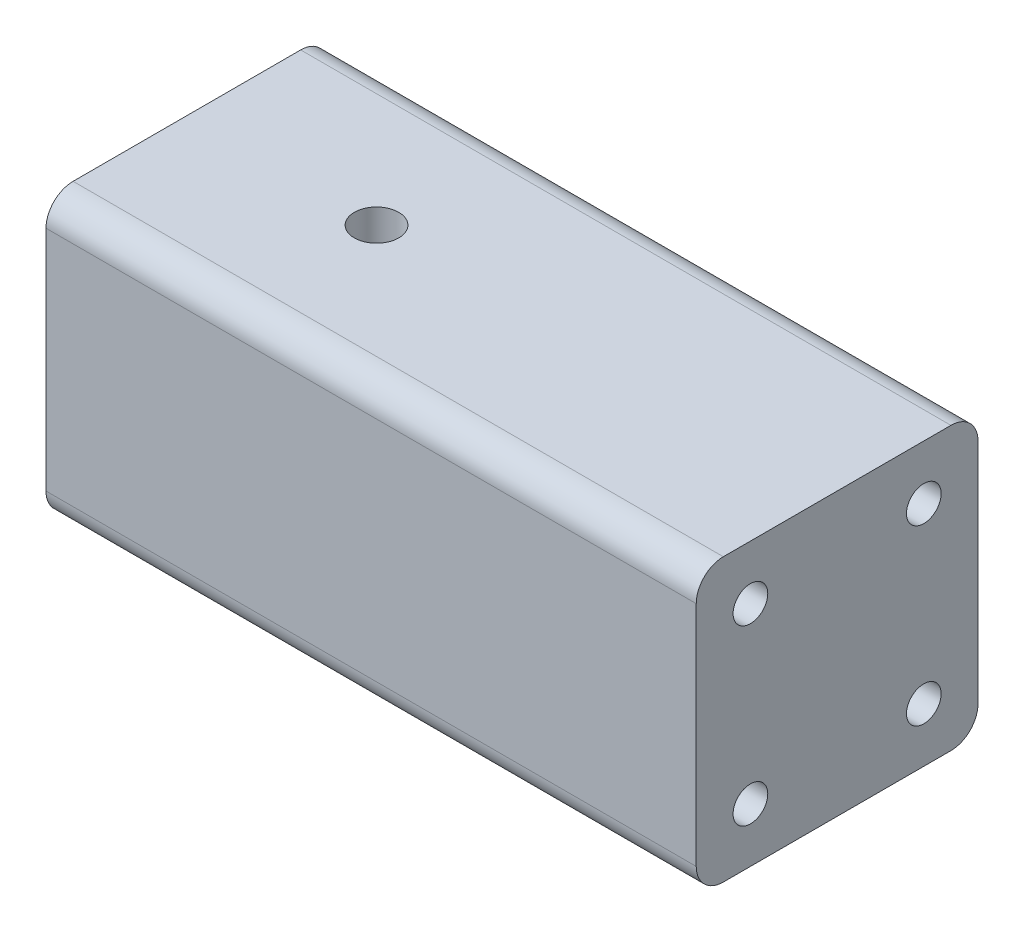
from build123d import *

# Parameters (mm, degrees)
BOSS_EXTRUDE1_DEPTH      = 39
BOSS_EXTRUDE1_DEPTH_BACK = 20
SKETCH1_W                = 42
SKETCH1_H                = 40
CUT_EXTRUDE3_DEPTH       = 68.939361812
CUT_EXTRUDE3_DEPTH_BACK  = 68.939361812
BOSS_EXTRUDE2_DEPTH      = 40
CUT_EXTRUDE7_START       = -10
SKETCH7_R                = 2.05
CUT_EXTRUDE7_DEPTH       = 116.132850877
CUT_EXTRUDE8_DEPTH       = 3.125
SKETCH9_R                = 2.778089848
BOSS_EXTRUDE3_DEPTH      = 6
CIRPATTERN1_COUNT        = 2
SKETCH10_W               = 6.985924482
SKETCH10_H               = 7.120269183
CUT_EXTRUDE13_DEPTH      = 8
SKETCH14_OUTSIDE_W       = 60.69
SKETCH14_OUTSIDE_H       = 58.69
CUT_EXTRUDE14_DEPTH      = 116.302529068
CHAMFER1_SIZE            = 5.5
SKETCH17_W               = 21.827069389
SKETCH17_H               = 22.909403407
BOSS_EXTRUDE4_DEPTH      = 15
SKETCH18_R               = 1.6
CUT_EXTRUDE15_DEPTH      = 107.928426814


with BuildPart() as part:
    # Sketch1 → Boss-Extrude1 (new, two sides: drawn at the far end of the back side and taken through both)
    with BuildSketch(Plane.ZY.offset(-BOSS_EXTRUDE1_DEPTH_BACK)):
        with Locations((70.454449321, -16.479540615)):
            Rectangle(SKETCH1_W, SKETCH1_H)
        with BuildLine():
            Line((77.147342539, -21.970352305), (75.054449321, -19.877459087))
            Line((75.054449321, -19.877459087), (75.054449321, -13.081622143))
            Line((75.054449321, -13.081622143), (77.147342539, -10.988728924))
            ThreePointArc((77.147342539, -10.988728924), (78.237132753, -10.771956173), (78.854449321, -11.695835705))
            Line((78.854449321, -11.695835705), (78.854449321, -13.429540615))
            Line((78.854449321, -13.429540615), (80.554449321, -13.429540615))
            Line((80.554449321, -13.429540615), (80.554449321, -6.979540615))
            ThreePointArc((80.554449321, -6.979540615), (80.378713389, -6.555276546), (79.954449321, -6.379540615))
            Line((79.954449321, -6.379540615), (73.504449321, -6.379540615))
            Line((73.504449321, -6.379540615), (73.504449321, -8.079540615))
            Line((73.504449321, -8.079540615), (75.23815423, -8.079540615))
            ThreePointArc((75.23815423, -8.079540615), (76.162033763, -8.696857182), (75.945261011, -9.786647396))
            Line((75.945261011, -9.786647396), (73.852367793, -11.879540615))
            Line((73.852367793, -11.879540615), (67.056530849, -11.879540615))
            Line((67.056530849, -11.879540615), (64.96363763, -9.786647396))
            ThreePointArc((64.96363763, -9.786647396), (64.746864878, -8.696857182), (65.670744411, -8.079540615))
            Line((65.670744411, -8.079540615), (67.404449321, -8.079540615))
            Line((67.404449321, -8.079540615), (67.404449321, -6.379540615))
            Line((67.404449321, -6.379540615), (60.954449321, -6.379540615))
            ThreePointArc((60.954449321, -6.379540615), (60.530185252, -6.555276546), (60.354449321, -6.979540615))
            Line((60.354449321, -6.979540615), (60.354449321, -13.429540615))
            Line((60.354449321, -13.429540615), (62.054449321, -13.429540615))
            Line((62.054449321, -13.429540615), (62.054449321, -11.695835705))
            ThreePointArc((62.054449321, -11.695835705), (62.671765888, -10.771956173), (63.761556102, -10.988728924))
            Line((63.761556102, -10.988728924), (65.854449321, -13.081622143))
            Line((65.854449321, -13.081622143), (65.854449321, -19.877459087))
            Line((65.854449321, -19.877459087), (63.761556102, -21.970352305))
            ThreePointArc((63.761556102, -21.970352305), (62.671765888, -22.187125057), (62.054449321, -21.263245524))
            Line((62.054449321, -21.263245524), (62.054449321, -19.529540615))
            Line((62.054449321, -19.529540615), (60.354449321, -19.529540615))
            Line((60.354449321, -19.529540615), (60.354449321, -25.979540615))
            ThreePointArc((60.354449321, -25.979540615), (60.530185252, -26.403804683), (60.954449321, -26.579540615))
            Line((60.954449321, -26.579540615), (67.404449321, -26.579540615))
            Line((67.404449321, -26.579540615), (67.404449321, -24.879540615))
            Line((67.404449321, -24.879540615), (65.670744411, -24.879540615))
            ThreePointArc((65.670744411, -24.879540615), (64.746864878, -24.262224047), (64.96363763, -23.172433833))
            Line((64.96363763, -23.172433833), (67.056530849, -21.079540615))
            Line((67.056530849, -21.079540615), (73.852367793, -21.079540615))
            Line((73.852367793, -21.079540615), (75.945261011, -23.172433833))
            ThreePointArc((75.945261011, -23.172433833), (76.162033763, -24.262224047), (75.23815423, -24.879540615))
            Line((75.23815423, -24.879540615), (73.504449321, -24.879540615))
            Line((73.504449321, -24.879540615), (73.504449321, -26.579540615))
            Line((73.504449321, -26.579540615), (79.954449321, -26.579540615))
            ThreePointArc((79.954449321, -26.579540615), (80.378713389, -26.403804683), (80.554449321, -25.979540615))
            Line((80.554449321, -25.979540615), (80.554449321, -19.529540615))
            Line((80.554449321, -19.529540615), (78.854449321, -19.529540615))
            Line((78.854449321, -19.529540615), (78.854449321, -21.263245524))
            ThreePointArc((78.854449321, -21.263245524), (78.237132753, -22.187125057), (77.147342539, -21.970352305))
        make_face(mode=Mode.SUBTRACT)
    extrude(amount=BOSS_EXTRUDE1_DEPTH + BOSS_EXTRUDE1_DEPTH_BACK)

    # Sketch2 → Cut-Extrude3 (cut, two sides: drawn at the far end of the back side and taken through both)
    with BuildSketch(Plane(origin=(0, 0, 91.454449321), x_dir=(-1, 0, 0), z_dir=(0, 0, -1)).offset(-CUT_EXTRUDE3_DEPTH_BACK)):
        with BuildLine():
            Line((9, 3.520459385), (39, 3.520459385))
            Line((39, 3.520459385), (39, -36.479540615))
            Line((39, -36.479540615), (30.968670474, -36.479540615))
            ThreePointArc((30.968670474, -36.479540615), (30.884335237, -36.480014542), (30.8, -36.479540615))
            Line((30.8, -36.479540615), (30.8, -37.552822487))
            Line((30.8, -37.552822487), (41.446354872, -37.552822487))
            Line((41.446354872, -37.552822487), (41.446354872, 6.899861608))
            Line((41.446354872, 6.899861608), (9, 6.899861608))
            Line((9, 6.899861608), (9, 3.520459385))
        make_face()
        with BuildLine():
            Line((39, -36.479540615), (39, 3.520459385))
            Line((39, 3.520459385), (9, 3.520459385))
            Line((9, 3.520459385), (36.19042941, -23.669970025))
            ThreePointArc((36.19042941, -23.669970025), (37.833109012, -31.808697916), (30.968670474, -36.479540615))
            Line((30.968670474, -36.479540615), (39, -36.479540615))
        make_face()
    extrude(amount=CUT_EXTRUDE3_DEPTH + CUT_EXTRUDE3_DEPTH_BACK, mode=Mode.SUBTRACT)

    # Sketch4 → Boss-Extrude2 (add)
    with BuildSketch(Plane(origin=(0, 0, 0), x_dir=(0, 0, -1), z_dir=(1, 0, 0))):
        with BuildLine():
            Line((-80.954449321, -3.479540615), (-59.954449321, -3.479540615))
            ThreePointArc((-59.954449321, -3.479540615), (-58.186682368, -4.211773662), (-57.454449321, -5.979540615))
            Line((-57.454449321, -5.979540615), (-57.454449321, -26.979540615))
            ThreePointArc((-57.454449321, -26.979540615), (-58.186682368, -28.747307568), (-59.954449321, -29.479540615))
            Line((-59.954449321, -29.479540615), (-80.954449321, -29.479540615))
            ThreePointArc((-80.954449321, -29.479540615), (-82.722216274, -28.747307568), (-83.454449321, -26.979540615))
            Line((-83.454449321, -26.979540615), (-83.454449321, -5.979540615))
            ThreePointArc((-83.454449321, -5.979540615), (-82.722216274, -4.211773662), (-80.954449321, -3.479540615))
        make_face()
        with BuildLine():
            Line((-62.054449321, -11.695835705), (-62.054449321, -13.429540615))
            Line((-62.054449321, -13.429540615), (-60.354449321, -13.429540615))
            Line((-60.354449321, -13.429540615), (-60.354449321, -6.979540615))
            ThreePointArc((-60.354449321, -6.979540615), (-60.530185252, -6.555276546), (-60.954449321, -6.379540615))
            Line((-60.954449321, -6.379540615), (-67.404449321, -6.379540615))
            Line((-67.404449321, -6.379540615), (-67.404449321, -8.079540615))
            Line((-67.404449321, -8.079540615), (-65.670744411, -8.079540615))
            ThreePointArc((-65.670744411, -8.079540615), (-64.746864878, -8.696857182), (-64.96363763, -9.786647396))
            Line((-64.96363763, -9.786647396), (-67.056530849, -11.879540615))
            Line((-67.056530849, -11.879540615), (-73.852367793, -11.879540615))
            Line((-73.852367793, -11.879540615), (-75.945261011, -9.786647396))
            ThreePointArc((-75.945261011, -9.786647396), (-76.162033763, -8.696857182), (-75.23815423, -8.079540615))
            Line((-75.23815423, -8.079540615), (-73.504449321, -8.079540615))
            Line((-73.504449321, -8.079540615), (-73.504449321, -6.379540615))
            Line((-73.504449321, -6.379540615), (-79.954449321, -6.379540615))
            ThreePointArc((-79.954449321, -6.379540615), (-80.378713389, -6.555276546), (-80.554449321, -6.979540615))
            Line((-80.554449321, -6.979540615), (-80.554449321, -13.429540615))
            Line((-80.554449321, -13.429540615), (-78.854449321, -13.429540615))
            Line((-78.854449321, -13.429540615), (-78.854449321, -11.695835705))
            ThreePointArc((-78.854449321, -11.695835705), (-78.237132753, -10.771956173), (-77.147342539, -10.988728924))
            Line((-77.147342539, -10.988728924), (-75.054449321, -13.081622143))
            Line((-75.054449321, -13.081622143), (-75.054449321, -19.877459087))
            Line((-75.054449321, -19.877459087), (-77.147342539, -21.970352305))
            ThreePointArc((-77.147342539, -21.970352305), (-78.237132753, -22.187125057), (-78.854449321, -21.263245524))
            Line((-78.854449321, -21.263245524), (-78.854449321, -19.529540615))
            Line((-78.854449321, -19.529540615), (-80.554449321, -19.529540615))
            Line((-80.554449321, -19.529540615), (-80.554449321, -25.979540615))
            ThreePointArc((-80.554449321, -25.979540615), (-80.378713389, -26.403804683), (-79.954449321, -26.579540615))
            Line((-79.954449321, -26.579540615), (-73.504449321, -26.579540615))
            Line((-73.504449321, -26.579540615), (-73.504449321, -24.879540615))
            Line((-73.504449321, -24.879540615), (-75.23815423, -24.879540615))
            ThreePointArc((-75.23815423, -24.879540615), (-76.162033763, -24.262224047), (-75.945261011, -23.172433833))
            Line((-75.945261011, -23.172433833), (-73.852367793, -21.079540615))
            Line((-73.852367793, -21.079540615), (-67.056530849, -21.079540615))
            Line((-67.056530849, -21.079540615), (-64.96363763, -23.172433833))
            ThreePointArc((-64.96363763, -23.172433833), (-64.746864878, -24.262224047), (-65.670744411, -24.879540615))
            Line((-65.670744411, -24.879540615), (-67.404449321, -24.879540615))
            Line((-67.404449321, -24.879540615), (-67.404449321, -26.579540615))
            Line((-67.404449321, -26.579540615), (-60.954449321, -26.579540615))
            ThreePointArc((-60.954449321, -26.579540615), (-60.530185252, -26.403804683), (-60.354449321, -25.979540615))
            Line((-60.354449321, -25.979540615), (-60.354449321, -19.529540615))
            Line((-60.354449321, -19.529540615), (-62.054449321, -19.529540615))
            Line((-62.054449321, -19.529540615), (-62.054449321, -21.263245524))
            ThreePointArc((-62.054449321, -21.263245524), (-62.671765888, -22.187125057), (-63.761556102, -21.970352305))
            Line((-63.761556102, -21.970352305), (-65.854449321, -19.877459087))
            Line((-65.854449321, -19.877459087), (-65.854449321, -13.081622143))
            Line((-65.854449321, -13.081622143), (-63.761556102, -10.988728924))
            ThreePointArc((-63.761556102, -10.988728924), (-62.671765888, -10.771956173), (-62.054449321, -11.695835705))
        make_face(mode=Mode.SUBTRACT)
    extrude(amount=-BOSS_EXTRUDE2_DEPTH)

    # Sketch7 → Cut-Extrude7 (cut)
    with BuildSketch(Plane(origin=(0, -3.479540615, 0), x_dir=(1, 0, 0), z_dir=(0, 1, 0)).offset(CUT_EXTRUDE7_START)):
        with Locations(Location((-22.5, -70.454449321, 0), (0, 0, 270))):
            Circle(SKETCH7_R)
    cut_extrude7 = extrude(amount=CUT_EXTRUDE7_DEPTH, mode=Mode.SUBTRACT)

    # Sketch8 → Cut-Extrude8 (cut, symmetric)
    with BuildSketch(Plane.ZY.offset(22.5)):
        Polygon((60.954449321, -6.379540615), (79.954449321, -6.379540615), (70.690797066, -16.49195704), align=None)
        Polygon((70.690797066, -16.49195704), (60.954449321, -26.579540615), (79.954449321, -26.579540615), align=None)
    extrude(amount=CUT_EXTRUDE8_DEPTH, both=True, mode=Mode.SUBTRACT)

    # CirPattern1: Cut-Extrude7 ×2 about axis
    cirpattern1_axis = Axis((-34, -16.479540615, 70.454449321), (-1, 0, 0))
    for i in range(1, CIRPATTERN1_COUNT):
        add(cut_extrude7.rotate(cirpattern1_axis, i * 360 / CIRPATTERN1_COUNT), mode=Mode.SUBTRACT)

    # Sketch14 outside → Cut-Extrude14 (cut, through all)
    with BuildSketch(Plane.ZY.offset(40)):
        with Locations((70.454, -16.48)):
            Rectangle(SKETCH14_OUTSIDE_W, SKETCH14_OUTSIDE_H)
        with BuildLine():
            Line((59.954449321, -29.479540615), (80.954449321, -29.479540615))
            ThreePointArc((80.954449321, -29.479540615), (82.722216274, -28.747307568), (83.454449321, -26.979540615))
            Line((83.454449321, -26.979540615), (83.454449321, -5.979540615))
            ThreePointArc((83.454449321, -5.979540615), (82.722216274, -4.211773662), (80.954449321, -3.479540615))
            Line((80.954449321, -3.479540615), (59.954449321, -3.479540615))
            ThreePointArc((59.954449321, -3.479540615), (58.186682368, -4.211773662), (57.454449321, -5.979540615))
            Line((57.454449321, -5.979540615), (57.454449321, -26.979540615))
            ThreePointArc((57.454449321, -26.979540615), (58.186682368, -28.747307568), (59.954449321, -29.479540615))
        make_face(mode=Mode.SUBTRACT)
    extrude(amount=-CUT_EXTRUDE14_DEPTH, mode=Mode.SUBTRACT)

    # Chamfer1
    chamfer1_edges = [part.edges().sort_by_distance(p)[0] for p in [
        (-25.625, -11.879540615, 70.454449321),
        (-25.625, -21.079540615, 70.454449321),
    ]]
    chamfer(chamfer1_edges, length=CHAMFER1_SIZE - 0.0001)  # a hair under: the kernel refuses the full size

    # Sketch17 → Boss-Extrude4 (add)
    with BuildSketch(Plane(origin=(20, 0, 0), x_dir=(0, 0, -1), z_dir=(1, 0, 0))):
        with Locations((-70.499546572, -16.637380993)):
            Rectangle(SKETCH17_W, SKETCH17_H)
    extrude(amount=-BOSS_EXTRUDE4_DEPTH)

    # Sketch18 → Cut-Extrude15 (cut, through all)
    with BuildSketch(Plane(origin=(20, 0, 0), x_dir=(0, 0, -1), z_dir=(1, 0, 0))):
        with Locations((-78.454449321, -8.479540615)):
            Circle(SKETCH18_R)
        with Locations((-62.454449321, -8.479540615)):
            Circle(SKETCH18_R)
        with Locations((-62.454449321, -24.479540615)):
            Circle(SKETCH18_R)
        with Locations((-78.454449321, -24.479540615)):
            Circle(SKETCH18_R)
    extrude(amount=-CUT_EXTRUDE15_DEPTH, mode=Mode.SUBTRACT)


with BuildPart() as body_2:
    # Sketch9 → Boss-Extrude3 (new body)
    with BuildSketch(Plane.ZY.offset(40)):
        with Locations((70.454449321, -16.479540615)):
            Circle(SKETCH9_R)
    extrude(amount=-BOSS_EXTRUDE3_DEPTH)

    # Sketch10 → Cut-Extrude13 (cut, symmetric)
    with BuildSketch(Plane.ZY.offset(40)):
        with Locations((70.605937199, -16.255142793)):
            Rectangle(SKETCH10_W, SKETCH10_H)
    extrude(amount=CUT_EXTRUDE13_DEPTH, both=True, mode=Mode.SUBTRACT)


solid = part.part
